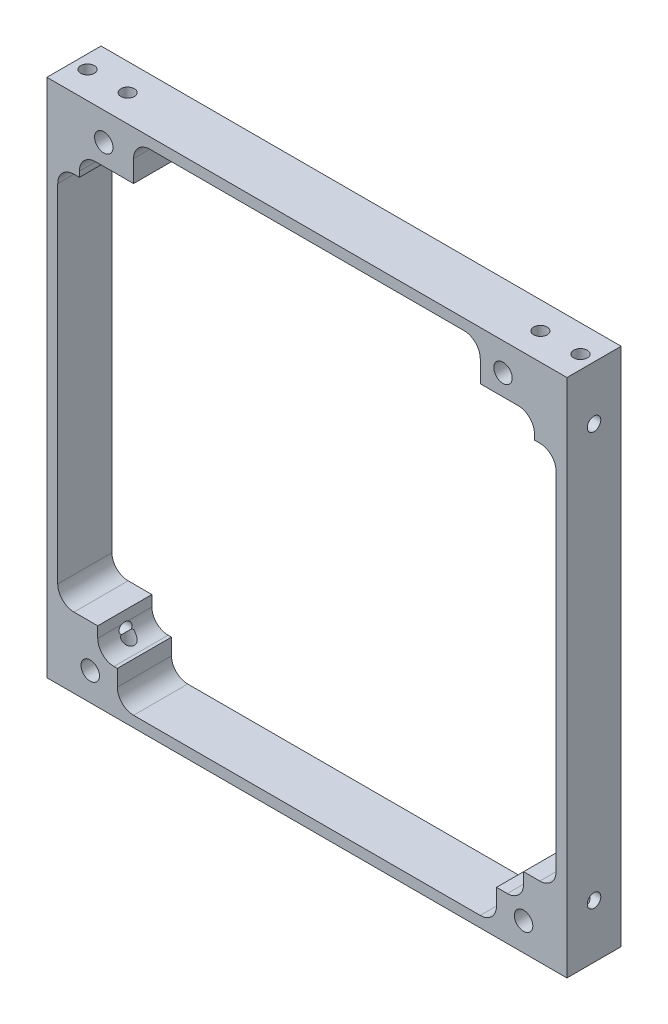
from build123d import *
from OCP.BRepAlgoAPI import BRepAlgoAPI_Cut
from OCP.TopTools import TopTools_ListOfShape

# Parameters (mm, degrees)
SKETCH1_W                  = 96
SKETCH1_H                  = 96
SKETCH1_W_2                = 84
SKETCH1_H_2                = 84
BOSS_EXTRUDE1_DEPTH        = 10
SKETCH5_W                  = 9
SKETCH5_H                  = 3.65
SKETCH5_W_2                = 1.3
SKETCH5_W_3                = 6.5
BOSS_EXTRUDE2_DEPTH        = 10
FILLET1_R                  = 3
BOSS_EXTRUDE3_START        = -10
BOSS_EXTRUDE3_DEPTH        = 10
M3_CLEARANCE_HOLE1_D       = 3.4
SKETCH11_R                 = 3
CUT_EXTRUDE2_DEPTH         = 0.5
M3_TAPPED_HOLE4_AT_2_COUNT = 2
M3_TAPPED_HOLE4_AT_2_PITCH = 91
CUT_EXTRUDE6_DEPTH         = 10
M3_TAPPED_HOLE6_AT_2_COUNT = 2
M3_TAPPED_HOLE6_AT_2_PITCH = 76.2
CIRPATTERN2_START          = -48
CIRPATTERN2_2_OUTLINE_R    = 1.25
CIRPATTERN2_2_DEPTH        = 9.49999434
CIRPATTERN2_START_2        = 38.5000001
CIRPATTERN2_3_OUTLINE_R    = 1.25
CIRPATTERN2_3_DEPTH        = 9.4999999
CIRPATTERN2_4_OUTLINE_R    = 1.25
CIRPATTERN2_4_DEPTH        = 10


with BuildPart() as part:
    # Sketch1 → Boss-Extrude1 (new body)
    with BuildSketch(Plane.XY):
        Rectangle(SKETCH1_W, SKETCH1_H)
        Rectangle(SKETCH1_W_2, SKETCH1_H_2, mode=Mode.SUBTRACT)
    extrude(amount=BOSS_EXTRUDE1_DEPTH)

    # Sketch5 → Boss-Extrude2 (add)
    with BuildSketch(Plane.XY.offset(10)):
        with Locations((36.2, 40.175)):
            Rectangle(SKETCH5_W, SKETCH5_H)
        with Locations((41.35, 40.175)):
            Rectangle(SKETCH5_W_2, SKETCH5_H)
        with Locations((-37.5, 40.175)):
            Rectangle(SKETCH5_W, SKETCH5_H)
        with Locations((-38.75, -40.175)):
            Rectangle(SKETCH5_W_3, SKETCH5_H)
        with Locations((38.75, -40.175)):
            Rectangle(SKETCH5_W_3, SKETCH5_H)
    extrude(amount=-BOSS_EXTRUDE2_DEPTH)

    # Fillet1
    fillet1_edges = [part.edges().sort_by_distance(p)[0] for p in [
        (42, 38.35, 5),
        (31.7, 42, 5),
        (-42, 38.35, 5),
        (-33, 42, 5),
        (-35.5, -42, 5),
        (-42, -38.35, 5),
        (42, -38.35, 5),
        (35.5, -42, 5),
    ]]
    fillet(fillet1_edges, radius=FILLET1_R)

    # Sketch23 → Boss-Extrude3 (add)
    with BuildSketch(Plane.XY.offset(10).offset(BOSS_EXTRUDE3_START)):
        with BuildLine():
            Line((35.5, -39), (35.5, -38.35))
            Line((35.5, -38.35), (39, -38.35))
            ThreePointArc((39, -38.35), (41.121320344, -37.471320344), (42, -35.35))
            Line((42, -35.35), (42, 35.35))
            ThreePointArc((42, 35.35), (41.121320344, 37.471320344), (39, 38.35))
            Line((39, 38.35), (31.7, 38.35))
            Line((31.7, 38.35), (31.7, 39))
            ThreePointArc((31.7, 39), (30.821320344, 41.121320344), (28.7, 42))
            Line((28.7, 42), (-30, 42))
            ThreePointArc((-30, 42), (-32.121320344, 41.121320344), (-33, 39))
            Line((-33, 39), (-33, 38.35))
            Line((-33, 38.35), (-39, 38.35))
            ThreePointArc((-39, 38.35), (-41.121320344, 37.471320344), (-42, 35.35))
            Line((-42, 35.35), (-42, -35.35))
            ThreePointArc((-42, -35.35), (-41.121320344, -37.471320344), (-39, -38.35))
            Line((-39, -38.35), (-35.5, -38.35))
            Line((-35.5, -38.35), (-35.5, -39))
            ThreePointArc((-35.5, -39), (-34.621320344, -41.121320344), (-32.5, -42))
            Line((-32.5, -42), (32.5, -42))
            ThreePointArc((32.5, -42), (34.621320344, -41.121320344), (35.5, -39))
        make_face()
    extrude(amount=BOSS_EXTRUDE3_DEPTH)

    # M3 Clearance Hole1 (through all)
    with Locations(Plane(origin=(-37.5, 42.85, 10), x_dir=(1, 0, 0), z_dir=(0, 0, 1))):
        with Locations((0, 0), (73.7, 0), (-2.5, -85.7), (77.5, -85.7)):
            Hole(M3_CLEARANCE_HOLE1_D / 2)

    # Sketch11 → Cut-Extrude2 (cut)
    with BuildSketch(Plane(origin=(0, 0, 0), x_dir=(-1, 0, 0), z_dir=(0, 0, -1))):
        with Locations((37.5, 42.85)):
            Circle(SKETCH11_R)
        with Locations((-36.2, 42.85)):
            Circle(SKETCH11_R)
        with Locations((-40, -42.85)):
            Circle(SKETCH11_R)
        with Locations((40, -42.85)):
            Circle(SKETCH11_R)
    extrude(amount=-CUT_EXTRUDE2_DEPTH, mode=Mode.SUBTRACT)

    # Sketch19 → M3 Tapped Hole4 (revolve, cut)
    with BuildSketch(Plane(origin=(45.5, -48, 5), x_dir=(0, 0, -1), z_dir=(1, 0, 0))):
        Polygon((0, 0), (0, 10.251075774), (1.25, 9.5), (1.25, 0), align=None)
    m3_tapped_hole4 = revolve(axis=Axis((45.5, -54.35, 5), (0, 1, 0)), mode=Mode.SUBTRACT)

    # M3 Tapped Hole4 at 2: M3 Tapped Hole4 ×2
    with Locations(*[(-i * M3_TAPPED_HOLE4_AT_2_PITCH, 0, 0) for i in range(1, M3_TAPPED_HOLE4_AT_2_COUNT)]):
        add(m3_tapped_hole4, mode=Mode.SUBTRACT)

    # Mirror2: M3 Tapped Hole4 across plane
    add(m3_tapped_hole4.mirror(Plane.ZX), mode=Mode.SUBTRACT)

    # Mirror2 copy 1 sketch → Mirror2 copy 1 (revolve, cut)
    with BuildSketch(Plane(origin=(-45.5, 48, 5), x_dir=(0, 0, -1), z_dir=(1, 0, 0))):
        Polygon((0, 0), (0, -10.251075774), (1.25, -9.5), (1.25, 0), align=None)
    revolve(axis=Axis((-45.5, 54.35, 5), (0, 1, 0)), mode=Mode.SUBTRACT)

    # Sketch22 → Cut-Extrude6 (cut)
    with BuildSketch(Plane.XY.offset(10)):
        with BuildLine():
            Line((-46, 32), (-46, -32))
            ThreePointArc((-46, -32), (-45.121320344, -34.121320344), (-43, -35))
            Line((-43, -35), (-38.614874983, -35))
            Line((-38.614874983, -35), (-38.614874983, -37))
            ThreePointArc((-38.614874983, -37), (-37.736195326, -39.121320344), (-35.614874983, -40))
            Line((-35.614874983, -40), (-35, -40))
            Line((-35, -40), (-35, -43))
            ThreePointArc((-35, -43), (-34.121320344, -45.121320344), (-32, -46))
            Line((-32, -46), (32, -46))
            ThreePointArc((32, -46), (34.121320344, -45.121320344), (35, -43))
            Line((35, -43), (35, -40))
            Line((35, -40), (37, -40))
            ThreePointArc((37, -40), (39.121320344, -39.121320344), (40, -37))
            Line((40, -37), (40, -35))
            Line((40, -35), (43, -35))
            ThreePointArc((43, -35), (45.121320344, -34.121320344), (46, -32))
            Line((46, -32), (46, 32))
            ThreePointArc((46, 32), (45.121320344, 34.121320344), (43, 35))
            Line((43, 35), (42, 35))
            Line((42, 35), (42, 36))
            ThreePointArc((42, 36), (41.121320344, 38.121320344), (39, 39))
            Line((39, 39), (32, 39))
            Line((32, 39), (32, 43))
            ThreePointArc((32, 43), (31.121320344, 45.121320344), (29, 46))
            Line((29, 46), (-29, 46))
            ThreePointArc((-29, 46), (-31.121320344, 45.121320344), (-32, 43))
            Line((-32, 43), (-32, 39))
            Line((-32, 39), (-39, 39))
            ThreePointArc((-39, 39), (-41.121320344, 38.121320344), (-42, 36))
            Line((-42, 36), (-42, 35))
            Line((-42, 35), (-43, 35))
            ThreePointArc((-43, 35), (-45.121320344, 34.121320344), (-46, 32))
        make_face()
    extrude(amount=-CUT_EXTRUDE6_DEPTH, mode=Mode.SUBTRACT)

    # Sketch28 → M3 Tapped Hole6 (revolve, cut)
    with BuildSketch(Plane(origin=(48, -38.099998017, 5), x_dir=(0, 0, -1), z_dir=(0, 1, 0))):
        Polygon((0, 0), (0, 10.251075774), (1.25, 9.5), (1.25, 0), align=None)
    m3_tapped_hole6 = revolve(axis=Axis((54.35, -38.099998017, 5), (-1, 0, 0)), mode=Mode.SUBTRACT)

    # M3 Tapped Hole6 at 2: M3 Tapped Hole6 ×2
    with Locations(*[(0, i * M3_TAPPED_HOLE6_AT_2_PITCH, 0) for i in range(1, M3_TAPPED_HOLE6_AT_2_COUNT)]):
        add(m3_tapped_hole6, mode=Mode.SUBTRACT)


with BuildPart() as cirpattern2_tool:
    # CirPattern2: read off the stored shape, not the designer's step
    # CirPattern2 outline → CirPattern2 (revolve)
    with BuildSketch(Plane(origin=(0, -38.100001983, 5), x_dir=(0, 1, 0), z_dir=(0, 0, -1))):
        Polygon((1.250001309, -38.500000787), (0.937983437, -38.312521535), (0, -38.312520526), (0, -48), (1.250001309, -48), align=None)
    revolve(axis=Axis((0, -38.100001983, 5), (1, 0, 0)))


with BuildPart() as part_1:
    add(part.part)

    # CirPattern2: cut by cirpattern2_tool, with a tolerance
    cirpattern2_stock = TopTools_ListOfShape()
    cirpattern2_stock.Append(part_1.part.wrapped)
    cirpattern2_tools = TopTools_ListOfShape()
    cirpattern2_tools.Append(cirpattern2_tool.part.wrapped)
    cirpattern2_cut = BRepAlgoAPI_Cut()
    cirpattern2_cut.SetArguments(cirpattern2_stock)
    cirpattern2_cut.SetTools(cirpattern2_tools)
    cirpattern2_cut.SetFuzzyValue(0.00001)
    cirpattern2_cut.Build()
    add(Compound.cast(cirpattern2_cut.Shape()).solids(), mode=Mode.REPLACE)


with BuildPart() as cirpattern2_2_tool:
    # CirPattern2 2 outline → CirPattern2 2 (new body)
    with BuildSketch(Plane(origin=(0, 0, 0), x_dir=(1, 0, 0), z_dir=(0, 1, 0)).offset(CIRPATTERN2_START)):
        with Locations((-38.100001983, -5)):
            Circle(CIRPATTERN2_2_OUTLINE_R)
        with Locations((38.099998017, -5)):
            Circle(CIRPATTERN2_2_OUTLINE_R)
    extrude(amount=CIRPATTERN2_2_DEPTH)


with BuildPart() as part_2:
    add(part_1.part)

    # CirPattern2 2: cut by cirpattern2_2_tool, with a tolerance
    cirpattern2_2_stock = TopTools_ListOfShape()
    cirpattern2_2_stock.Append(part_2.part.wrapped)
    cirpattern2_2_tools = TopTools_ListOfShape()
    cirpattern2_2_tools.Append(cirpattern2_2_tool.part.wrapped)
    cirpattern2_2_cut = BRepAlgoAPI_Cut()
    cirpattern2_2_cut.SetArguments(cirpattern2_2_stock)
    cirpattern2_2_cut.SetTools(cirpattern2_2_tools)
    cirpattern2_2_cut.SetFuzzyValue(0.00001)
    cirpattern2_2_cut.Build()
    add(Compound.cast(cirpattern2_2_cut.Shape()).solids(), mode=Mode.REPLACE)


with BuildPart() as cirpattern2_3_tool:
    # CirPattern2 3 outline → CirPattern2 3 (new body)
    with BuildSketch(Plane(origin=(0, 0, 0), x_dir=(1, 0, 0), z_dir=(0, 1, 0)).offset(CIRPATTERN2_START_2)):
        with Locations((-38.100001983, -5)):
            Circle(CIRPATTERN2_3_OUTLINE_R)
        with Locations((38.099998017, -5)):
            Circle(CIRPATTERN2_3_OUTLINE_R)
    extrude(amount=CIRPATTERN2_3_DEPTH)


with BuildPart() as part_3:
    add(part_2.part)

    # CirPattern2 3: cut by cirpattern2_3_tool, with a tolerance
    cirpattern2_3_stock = TopTools_ListOfShape()
    cirpattern2_3_stock.Append(part_3.part.wrapped)
    cirpattern2_3_tools = TopTools_ListOfShape()
    cirpattern2_3_tools.Append(cirpattern2_3_tool.part.wrapped)
    cirpattern2_3_cut = BRepAlgoAPI_Cut()
    cirpattern2_3_cut.SetArguments(cirpattern2_3_stock)
    cirpattern2_3_cut.SetTools(cirpattern2_3_tools)
    cirpattern2_3_cut.SetFuzzyValue(0.00001)
    cirpattern2_3_cut.Build()
    add(Compound.cast(cirpattern2_3_cut.Shape()).solids(), mode=Mode.REPLACE)


with BuildPart() as cirpattern2_4_tool:
    # CirPattern2 4 outline → CirPattern2 4 (new body)
    with BuildSketch(Plane.YZ.offset(CIRPATTERN2_START)):
        with Locations((38.099998017, 5)):
            Circle(CIRPATTERN2_4_OUTLINE_R)
    extrude(amount=CIRPATTERN2_4_DEPTH)


with BuildPart() as part_4:
    add(part_3.part)

    # CirPattern2 4: cut by cirpattern2_4_tool, with a tolerance
    cirpattern2_4_stock = TopTools_ListOfShape()
    cirpattern2_4_stock.Append(part_4.part.wrapped)
    cirpattern2_4_tools = TopTools_ListOfShape()
    cirpattern2_4_tools.Append(cirpattern2_4_tool.part.wrapped)
    cirpattern2_4_cut = BRepAlgoAPI_Cut()
    cirpattern2_4_cut.SetArguments(cirpattern2_4_stock)
    cirpattern2_4_cut.SetTools(cirpattern2_4_tools)
    cirpattern2_4_cut.SetFuzzyValue(0.00001)
    cirpattern2_4_cut.Build()
    add(Compound.cast(cirpattern2_4_cut.Shape()).solids(), mode=Mode.REPLACE)


with BuildPart() as cirpattern2_5_tool:
    # CirPattern2 5 outline → CirPattern2 5 (revolve)
    with BuildSketch(Plane(origin=(-38.099998017, 0, 5), x_dir=(1, 0, 0), z_dir=(0, 0, 1))):
        Polygon((1.25, -38.5), (0.937981963, -38.312520649), (0.112949909, -38.312520648), (0.112949909, -38.50000566), align=None)
    revolve(axis=Axis((-38.099998017, 0, 5), (0, 1, 0)))


with BuildPart() as part_5:
    add(part_4.part)

    # CirPattern2 5: cut by cirpattern2_5_tool, with a tolerance
    cirpattern2_5_stock = TopTools_ListOfShape()
    cirpattern2_5_stock.Append(part_5.part.wrapped)
    cirpattern2_5_tools = TopTools_ListOfShape()
    cirpattern2_5_tools.Append(cirpattern2_5_tool.part.wrapped)
    cirpattern2_5_cut = BRepAlgoAPI_Cut()
    cirpattern2_5_cut.SetArguments(cirpattern2_5_stock)
    cirpattern2_5_cut.SetTools(cirpattern2_5_tools)
    cirpattern2_5_cut.SetFuzzyValue(0.00001)
    cirpattern2_5_cut.Build()
    add(Compound.cast(cirpattern2_5_cut.Shape()).solids(), mode=Mode.REPLACE)


solid = part_5.part
